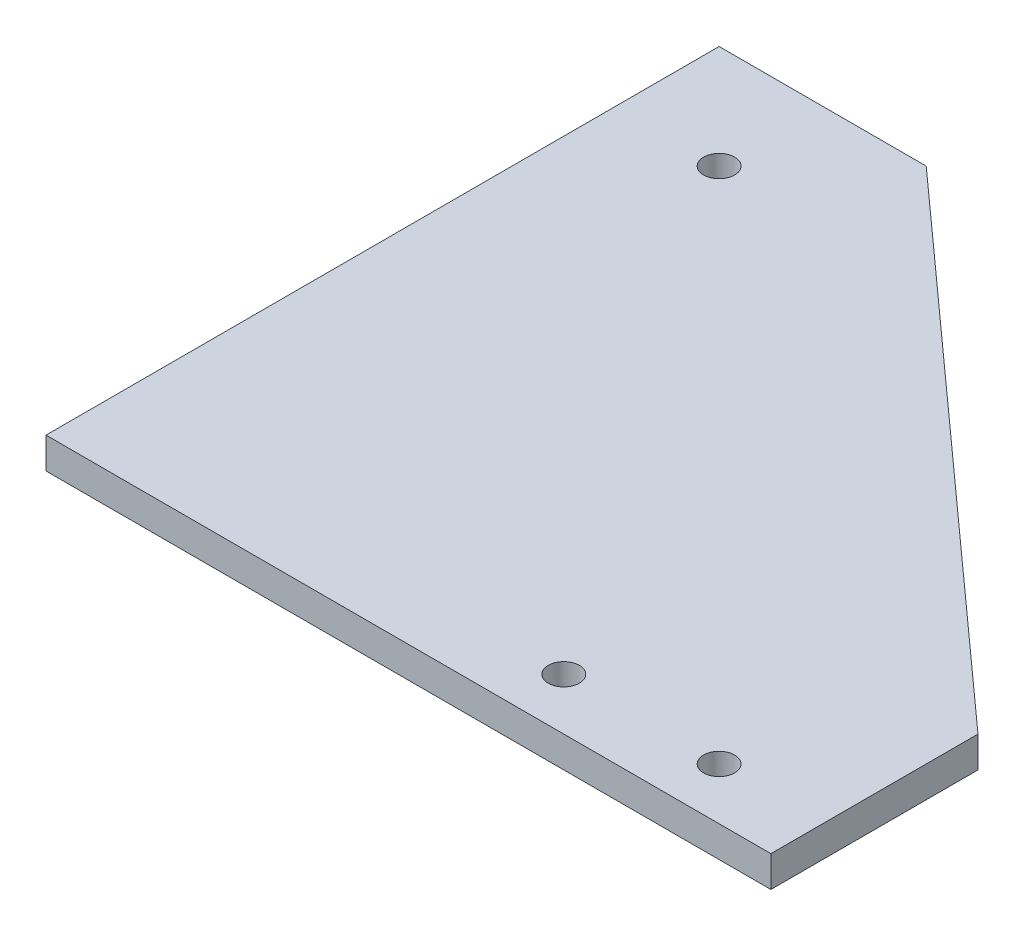
from build123d import *

# Parameters (mm, degrees)
SKETCH1_R           = 1.5
BOSS_EXTRUDE1_DEPTH = 3
SKETCH4_R           = 1.5
CUT_EXTRUDE1_DEPTH  = 5
SKETCH5_R           = 1.5
CUT_EXTRUDE2_DEPTH  = 49.645455777


with BuildPart() as part:
    # Sketch1 → Boss-Extrude1 (new body)
    with BuildSketch(Plane(origin=(0, 0, 0), x_dir=(1, 0, 0), z_dir=(0, 1, 0))):
        Polygon((35.579220967, -33.037848041), (-34.420779033, -33.037848041), (-34.420779033, 31.962151959), (-14.420779033, 31.962151959), (35.579220967, -13.037848041), align=None)
        with Locations((25.579220967, -28.037848041)):
            Circle(SKETCH1_R, mode=Mode.SUBTRACT)
    extrude(amount=BOSS_EXTRUDE1_DEPTH)

    # Sketch4 → Cut-Extrude1 (cut)
    with BuildSketch(Plane(origin=(0, 3, 0), x_dir=(-1, 0, 0), z_dir=(0, 1, 0))):
        with Locations((-10.579220967, 28.037848041)):
            Circle(SKETCH4_R)
    extrude(amount=-CUT_EXTRUDE1_DEPTH, mode=Mode.SUBTRACT)

    # Sketch5 → Cut-Extrude2 (cut, through all)
    with BuildSketch(Plane(origin=(0, 3, 0), x_dir=(-1, 0, 0), z_dir=(0, 1, 0))):
        with Locations((24.420779033, -21.962151959)):
            Circle(SKETCH5_R)
    extrude(amount=-CUT_EXTRUDE2_DEPTH, mode=Mode.SUBTRACT)


solid = part.part
